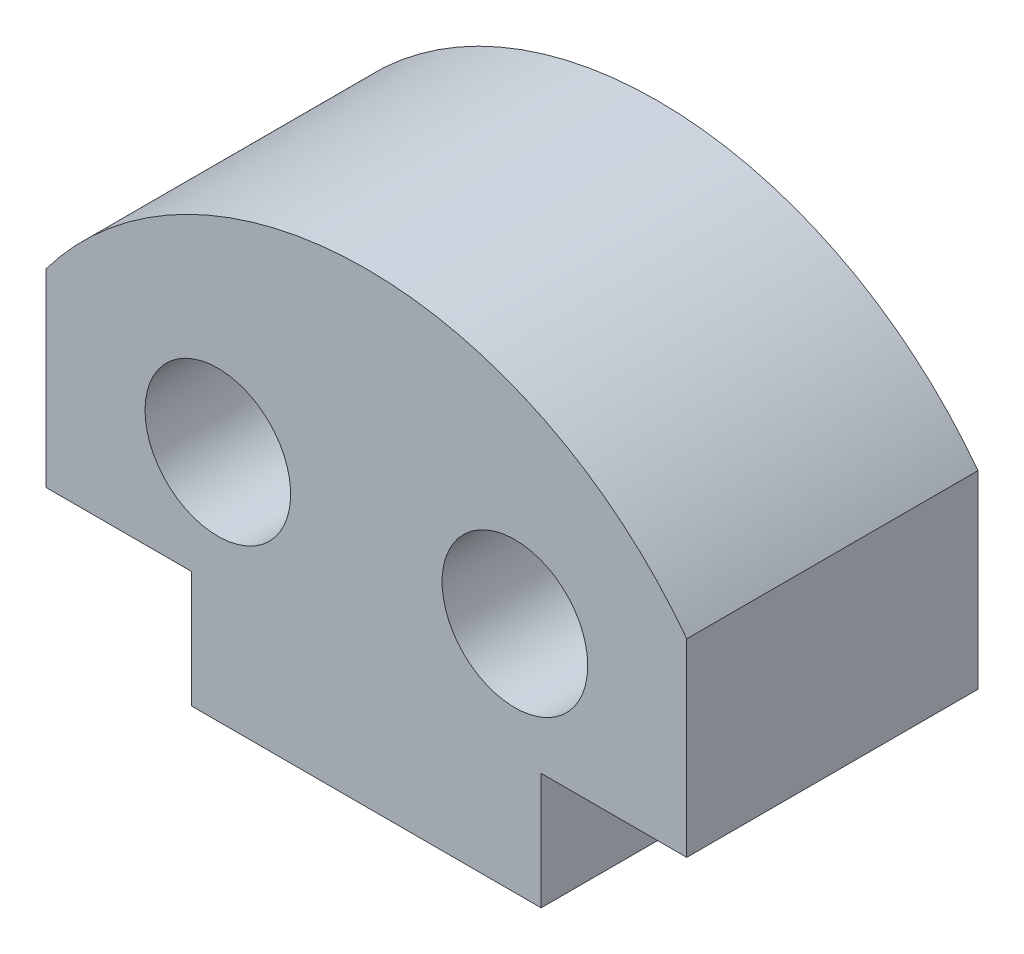
from build123d import *

# Parameters (mm, degrees)
MODEL_R             = 1.25
BOSS_EXTRUDE1_DEPTH = 5


with BuildPart() as part:
    # Model → Boss-Extrude1 (new body)
    with BuildSketch(Plane.XY):
        with BuildLine():
            Line((0, 2), (-2.5, 2))
            Line((-2.5, 2), (-2.5, 5.25))
            ThreePointArc((-2.5, 5.25), (3, 8), (8.5, 5.25))
            Line((8.5, 5.25), (8.5, 2))
            Line((8.5, 2), (6, 2))
            Line((6, 2), (6, 0))
            Line((6, 0), (0, 0))
            Line((0, 0), (0, 2))
        make_face()
        with Locations((0.45, 4)):
            Circle(MODEL_R, mode=Mode.SUBTRACT)
        with Locations((5.55, 4)):
            Circle(MODEL_R, mode=Mode.SUBTRACT)
    extrude(amount=BOSS_EXTRUDE1_DEPTH)


solid = part.part
